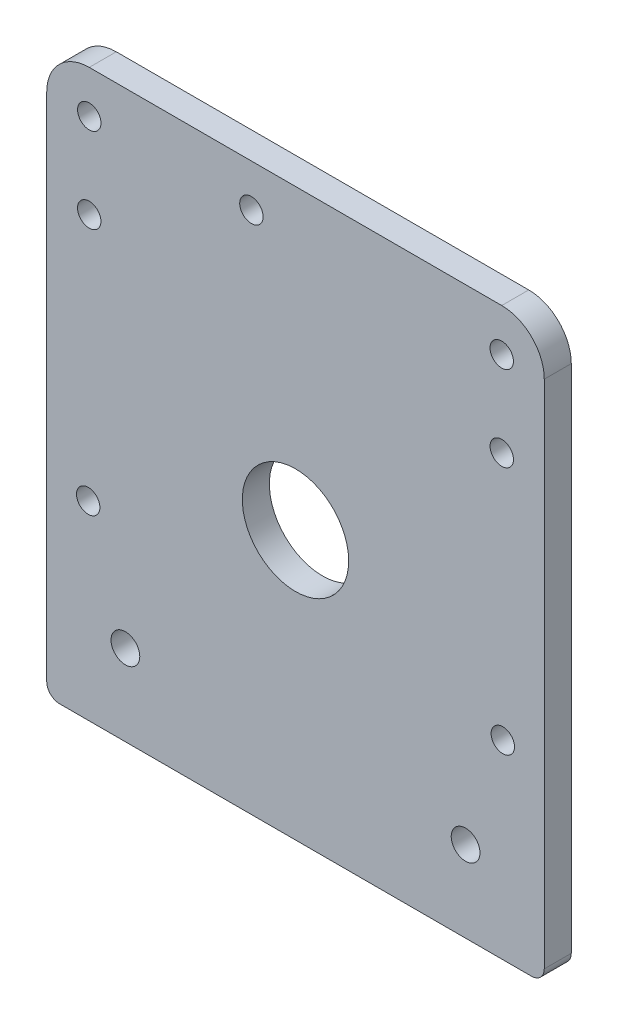
from build123d import *

# Parameters (mm, degrees)
SKETCH1_W           = 117
SKETCH1_H           = 133.1
SKETCH1_R           = 2.75
SKETCH1_R_2         = 3.38
SKETCH1_R_3         = 12.5
BOSS_EXTRUDE1_DEPTH = 6.35
FILLET1_R           = 10
FILLET2_R           = 3


with BuildPart() as part:
    # Sketch1 → Boss-Extrude1 (new body)
    with BuildSketch(Plane.XY):
        with Locations((0, 3.45)):
            Rectangle(SKETCH1_W, SKETCH1_H)
        with Locations((-48.75, -18.4)):
            Circle(SKETCH1_R, mode=Mode.SUBTRACT)
        with Locations((48.75, -18.4)):
            Circle(SKETCH1_R, mode=Mode.SUBTRACT)
        with Locations((-10.368974359, 60.010374765)):
            Circle(SKETCH1_R, mode=Mode.SUBTRACT)
        with Locations((-40, -44.05)):
            Circle(SKETCH1_R_2, mode=Mode.SUBTRACT)
        with Locations((40, -44.05)):
            Circle(SKETCH1_R_2, mode=Mode.SUBTRACT)
        Circle(SKETCH1_R_3, mode=Mode.SUBTRACT)
        with Locations((48.5, 60.010374765)):
            Circle(SKETCH1_R, mode=Mode.SUBTRACT)
        with Locations((48.51, 40)):
            Circle(SKETCH1_R, mode=Mode.SUBTRACT)
        with Locations((-48.51, 40)):
            Circle(SKETCH1_R, mode=Mode.SUBTRACT)
        with Locations((-48.5, 60.010374765)):
            Circle(SKETCH1_R, mode=Mode.SUBTRACT)
    extrude(amount=BOSS_EXTRUDE1_DEPTH)

    # Fillet1
    fillet1_edges = [part.edges().sort_by_distance(p)[0] for p in [
        (58.5, 70, 3.175),
        (-58.5, 70, 3.175),
    ]]
    fillet(fillet1_edges, radius=FILLET1_R)

    # Fillet2
    fillet2_edges = [part.edges().sort_by_distance(p)[0] for p in [
        (-58.5, -63.1, 3.175),
        (58.5, -63.1, 3.175),
    ]]
    fillet(fillet2_edges, radius=FILLET2_R)


solid = part.part
